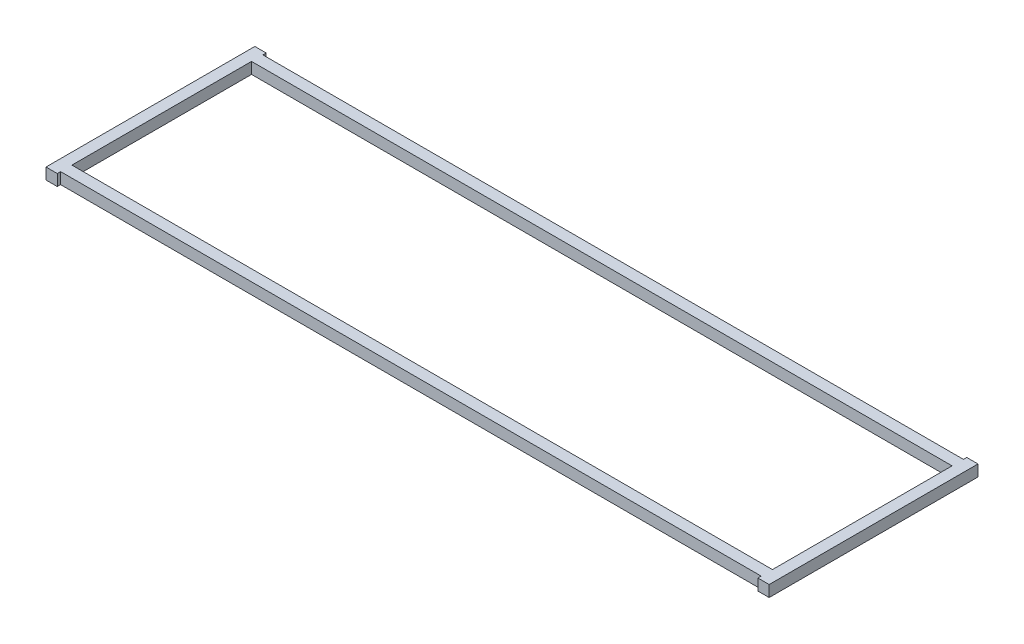
from build123d import *

# Parameters (mm, degrees)
SKETCH1_W           = 393.7
SKETCH1_H           = 100.9392952
BOSS_EXTRUDE1_DEPTH = 6.35


with BuildPart() as part:
    # Sketch1 → Boss-Extrude1 (new body)
    with BuildSketch(Plane(origin=(0, 0, 0), x_dir=(1, 0, 0), z_dir=(0, 1, 0))):
        Polygon((196.85, 58.683525), (203.2, 58.683525), (203.2, -58.683525), (196.85, -58.683525), (196.85, -56.8196476), (-196.85, -56.8196476), (-196.85, -58.683525), (-203.2, -58.683525), (-203.2, 58.683525), (-196.85, 58.683525), (-196.85, 56.8196476), (196.85, 56.8196476), align=None)
        Rectangle(SKETCH1_W, SKETCH1_H, mode=Mode.SUBTRACT)
    extrude(amount=BOSS_EXTRUDE1_DEPTH)


solid = part.part
